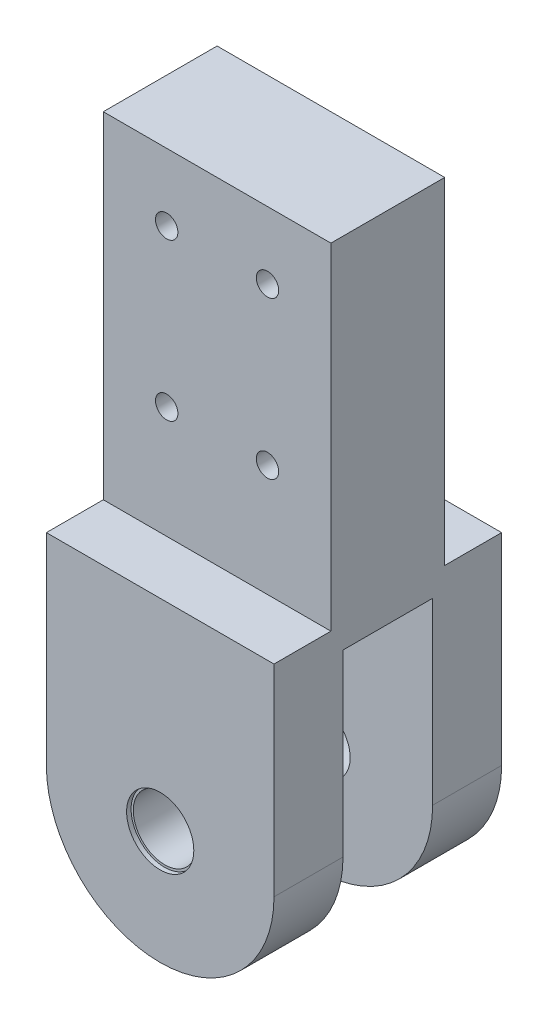
from build123d import *

# Parameters (mm, degrees)
SKETCH1_R           = 7
SKETCH1_R_2         = 2.5
BOSS_EXTRUDE1_DEPTH = 25.4
SKETCH2_W           = 20
SKETCH2_H           = 65.4
CUT_EXTRUDE1_DEPTH  = 133.762193414
SKETCH3_R           = 7.5
CUT_EXTRUDE2_DEPTH  = 1
CUT_EXTRUDE3_START  = -1
SKETCH4_R           = 7.5
CUT_EXTRUDE3_DEPTH  = 1
SKETCH6_W           = 12.7
SKETCH6_H           = 75
CUT_EXTRUDE4_DEPTH  = 133.762193414


with BuildPart() as part:
    # Sketch1 → Boss-Extrude1 (new, symmetric)
    with BuildSketch(Plane.XY):
        with BuildLine():
            Line((-25.4, 0), (-25.4, 120))
            Line((-25.4, 120), (25.4, 120))
            Line((25.4, 120), (25.4, 0))
            ThreePointArc((25.4, 0), (0, -25.4), (-25.4, 0))
        make_face()
        Circle(SKETCH1_R, mode=Mode.SUBTRACT)
        with Locations((-11.25, 105)):
            Circle(SKETCH1_R_2, mode=Mode.SUBTRACT)
        with Locations((11.25, 105)):
            Circle(SKETCH1_R_2, mode=Mode.SUBTRACT)
        with Locations((11.25, 70)):
            Circle(SKETCH1_R_2, mode=Mode.SUBTRACT)
        with Locations((-11.25, 70)):
            Circle(SKETCH1_R_2, mode=Mode.SUBTRACT)
    extrude(amount=BOSS_EXTRUDE1_DEPTH, both=True)

    # Sketch2 → Cut-Extrude1 (cut, through all)
    with BuildSketch(Plane(origin=(25.4, 0, 0), x_dir=(0, 0, -1), z_dir=(1, 0, 0))):
        with Locations((0, 7.3)):
            Rectangle(SKETCH2_W, SKETCH2_H)
    extrude(amount=-CUT_EXTRUDE1_DEPTH, mode=Mode.SUBTRACT)

    # Sketch3 → Cut-Extrude2 (cut)
    with BuildSketch(Plane.XY.offset(25.4)):
        Circle(SKETCH3_R)
    extrude(amount=-CUT_EXTRUDE2_DEPTH, mode=Mode.SUBTRACT)

    # Sketch4 → Cut-Extrude3 (cut)
    with BuildSketch(Plane(origin=(0, 0, -25.4), x_dir=(-1, 0, 0), z_dir=(0, 0, -1)).offset(CUT_EXTRUDE3_START)):
        Circle(SKETCH4_R)
    extrude(amount=CUT_EXTRUDE3_DEPTH, mode=Mode.SUBTRACT)

    # Sketch6 → Cut-Extrude4 (cut, through all)
    with BuildSketch(Plane(origin=(25.4, 0, 0), x_dir=(0, 0, -1), z_dir=(1, 0, 0))):
        with Locations((-19.05, 82.5)):
            Rectangle(SKETCH6_W, SKETCH6_H)
        with Locations((19.05, 82.5)):
            Rectangle(SKETCH6_W, SKETCH6_H)
    extrude(amount=-CUT_EXTRUDE4_DEPTH, mode=Mode.SUBTRACT)


solid = part.part
